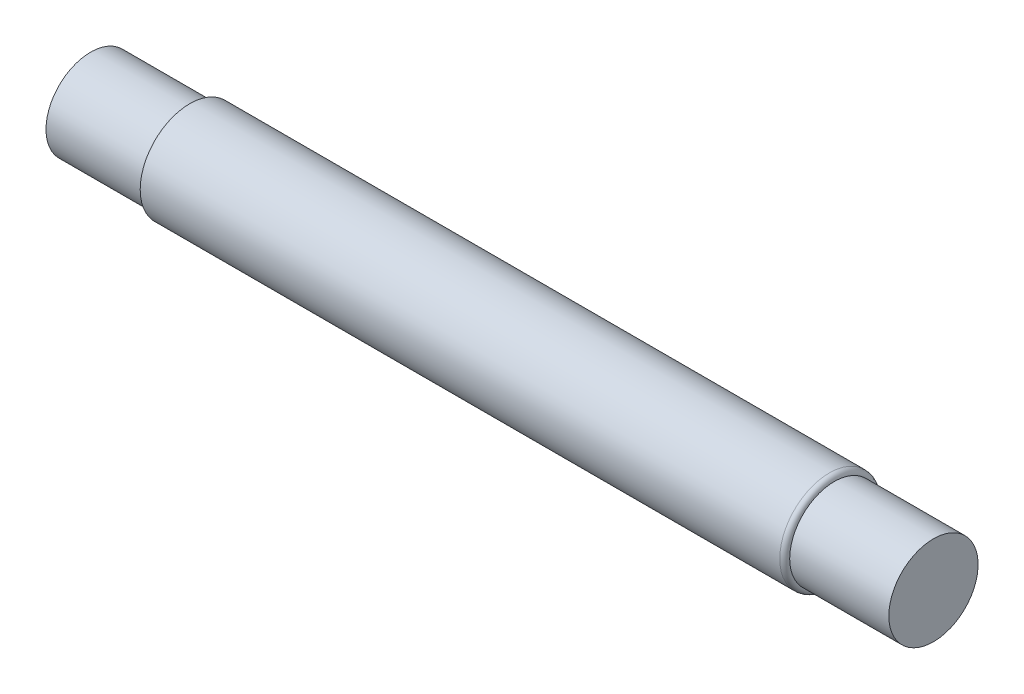
from build123d import *

# Parameters (mm, degrees)
FILLET_1_R = 2


with BuildPart() as part:
    # 草图8 → 旋转1 (revolve)
    with BuildSketch(Plane.XY, mode=Mode.PRIVATE) as revolve_1_sk:
        Polygon((0, 0), (340, 0), (340, 18), (300, 18), (300, 20), (40, 20), (40, 18), (0, 18), align=None)
    revolve(revolve_1_sk.sketch.rotate(Axis((0, 0, 0), (1, 0, 0)), 90), axis=Axis((0, 0, 0), (1, 0, 0)))

    # 圆角1
    fillet_1_edges = [part.edges().sort_by_distance(p)[0] for p in [
        (300, 0, -20),
    ]]
    fillet(fillet_1_edges, radius=FILLET_1_R - 0.0001)  # a hair under: the kernel refuses the full size


solid = part.part
